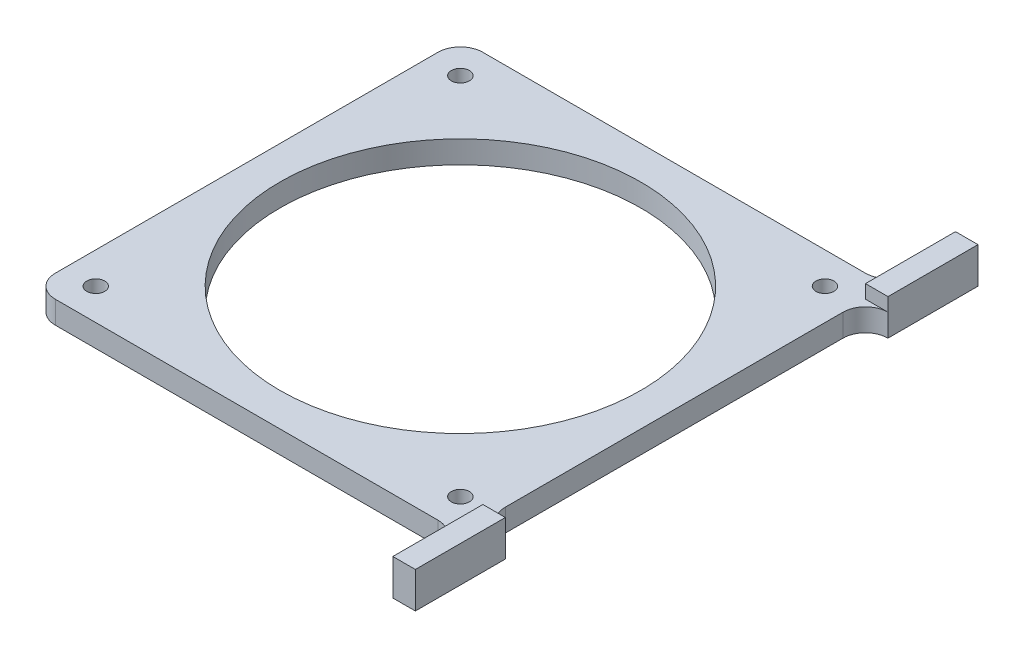
from build123d import *

# Parameters (mm, degrees)
SKETCH1_W             = 95
SKETCH1_H             = 95
SKETCH1_W_2           = 81
SKETCH1_H_2           = 81
SKETCH1_R             = 40.1
BOSS_EXTRUDE1_DEPTH   = 5
F_4_0MM_DOWEL_HOLE1_D = 4
SKETCH5_W             = 5
SKETCH5_H             = 20
BOSS_EXTRUDE2_DEPTH   = 5
SKETCH6_W             = 5
SKETCH6_H             = 20
BOSS_EXTRUDE3_DEPTH   = 3
FILLET1_R             = 5


with BuildPart() as part:
    # Sketch1 → Boss-Extrude1 (new body)
    # profile 1 of 2: a face of its own
    with BuildSketch(Plane(origin=(0, 0, 0), x_dir=(1, 0, 0), z_dir=(0, 1, 0))):
        Rectangle(SKETCH1_W, SKETCH1_H)
        Rectangle(SKETCH1_W_2, SKETCH1_H_2, mode=Mode.SUBTRACT)
    # profile 2 of 2: a face of its own
    with BuildSketch(Plane(origin=(0, 0, 0), x_dir=(1, 0, 0), z_dir=(0, 1, 0))):
        Rectangle(SKETCH1_W_2, SKETCH1_H_2)
        with Locations(Location((0, 0, 0), (0, 0, 270))):
            Circle(SKETCH1_R, mode=Mode.SUBTRACT)
    extrude(amount=BOSS_EXTRUDE1_DEPTH)

    # Ø4.0mm Dowel Hole1 (through all)
    with Locations(Plane(origin=(0, 0, 0), x_dir=(-1, 0, 0), z_dir=(0, -1, 0))):
        with Locations((40.5, -40.5), (-40.5, -40.5), (-40.5, 40.5), (40.5, 40.5)):
            Hole(F_4_0MM_DOWEL_HOLE1_D / 2)

    # Sketch5 → Boss-Extrude2 (add)
    with BuildSketch(Plane(origin=(0, 0, 0), x_dir=(1, 0, 0), z_dir=(0, 1, 0))):
        with Locations((50, -52.5)):
            Rectangle(SKETCH5_W, SKETCH5_H)
        with Locations((50, 52.5)):
            Rectangle(SKETCH5_W, SKETCH5_H)
    extrude(amount=BOSS_EXTRUDE2_DEPTH)

    # Sketch6 → Boss-Extrude3 (add)
    with BuildSketch(Plane(origin=(0, 5, 0), x_dir=(1, 0, 0), z_dir=(0, 1, 0))):
        with Locations((50, -52.5)):
            Rectangle(SKETCH6_W, SKETCH6_H)
        with Locations((50, 52.5)):
            Rectangle(SKETCH6_W, SKETCH6_H)
    extrude(amount=BOSS_EXTRUDE3_DEPTH)

    # Fillet1
    fillet1_edges = [part.edges().sort_by_distance(p)[0] for p in [
        (-47.5, 2.5, -47.5),
        (-47.5, 2.5, 47.5),
        (47.5, 2.5, 47.5),
        (47.5, 2.5, 42.5),
        (47.5, 2.5, -42.5),
        (47.5, 2.5, -47.5),
    ]]
    fillet(fillet1_edges, radius=FILLET1_R - 0.0001)  # a hair under: the kernel refuses the full size


solid = part.part
